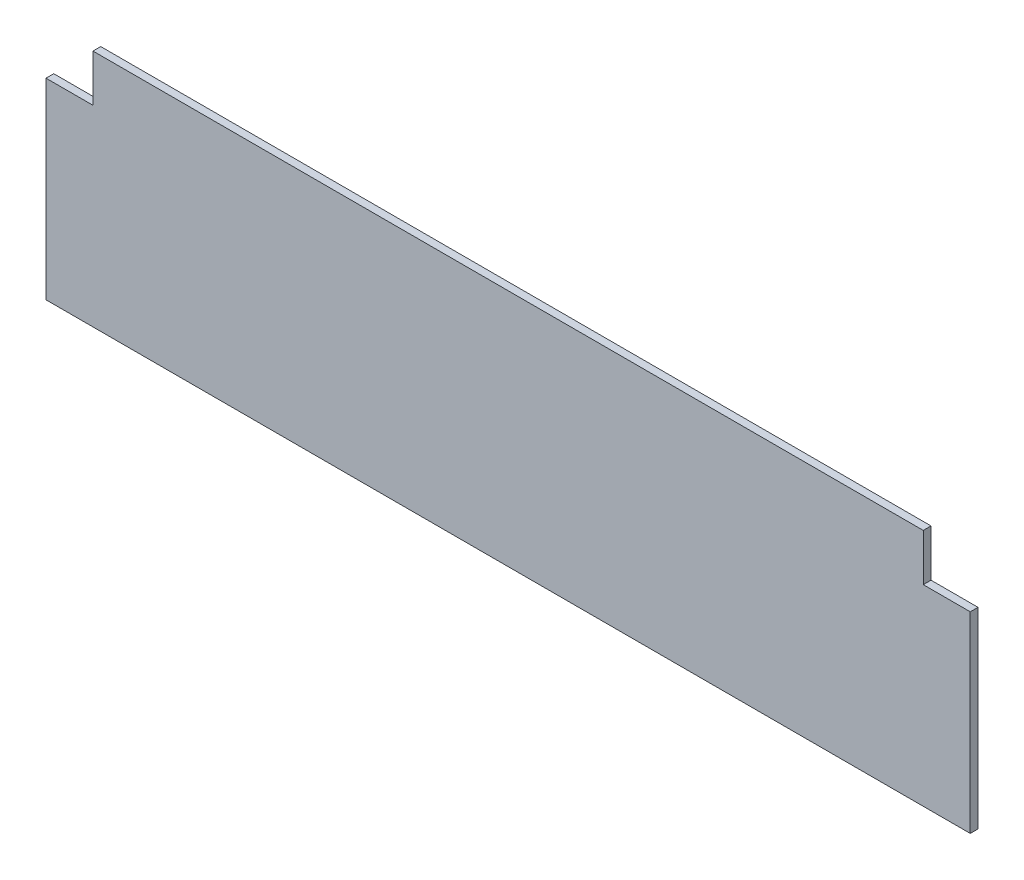
from build123d import *

# Parameters (mm, degrees)
BOSS_EXTRUDE1_DEPTH = 3.3


with BuildPart() as part:
    # Sketch1 → Boss-Extrude1 (new body)
    with BuildSketch(Plane.XY):
        Polygon((0, -121.512388333), (393.4, -121.512388333), (393.4, -39.804293747), (373.4, -39.804293747), (373.4, -19.804293747), (20, -19.804293747), (20, -39.804293747), (0, -39.804293747), align=None)
    extrude(amount=-BOSS_EXTRUDE1_DEPTH)


solid = part.part
